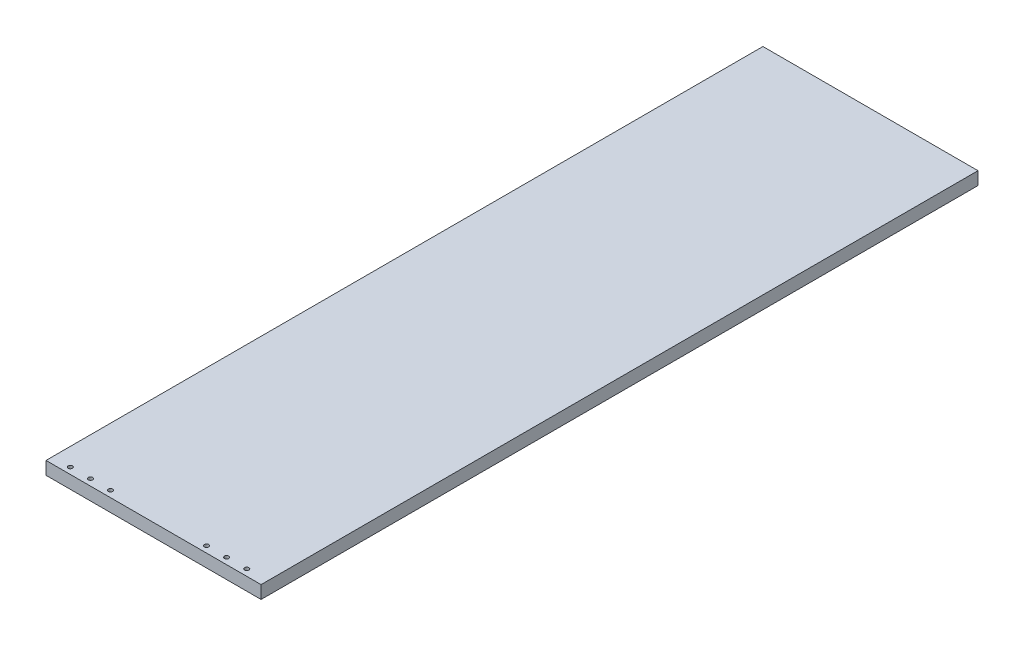
from build123d import *

# Parameters (mm, degrees)
SKETCH_2_W          = 300
SKETCH_2_H          = 1000
EXTRUDE_1_DEPTH     = 18
SKETCH_3_R          = 3
CUT_EXTRUDE_1_DEPTH = 9


with BuildPart() as part:
    # Эскиз2 → Бобышка-Вытянуть1 (new body)
    with BuildSketch(Plane(origin=(0, 0, 0), x_dir=(1, 0, 0), z_dir=(0, 1, 0))):
        with Locations((150, 500)):
            Rectangle(SKETCH_2_W, SKETCH_2_H)
    extrude(amount=EXTRUDE_1_DEPTH)

    # Эскиз3 → Вырез-Вытянуть1 (cut)
    with BuildSketch(Plane(origin=(0, 18, 0), x_dir=(1, 0, 0), z_dir=(0, 1, 0))):
        with Locations((25, 9)):
            Circle(SKETCH_3_R)
        with Locations((53, 9)):
            Circle(SKETCH_3_R)
        with Locations((81, 9)):
            Circle(SKETCH_3_R)
        with Locations((215, 9)):
            Circle(SKETCH_3_R)
        with Locations((243, 9)):
            Circle(SKETCH_3_R)
        with Locations((271, 9)):
            Circle(SKETCH_3_R)
    extrude(amount=-CUT_EXTRUDE_1_DEPTH, mode=Mode.SUBTRACT)


solid = part.part
